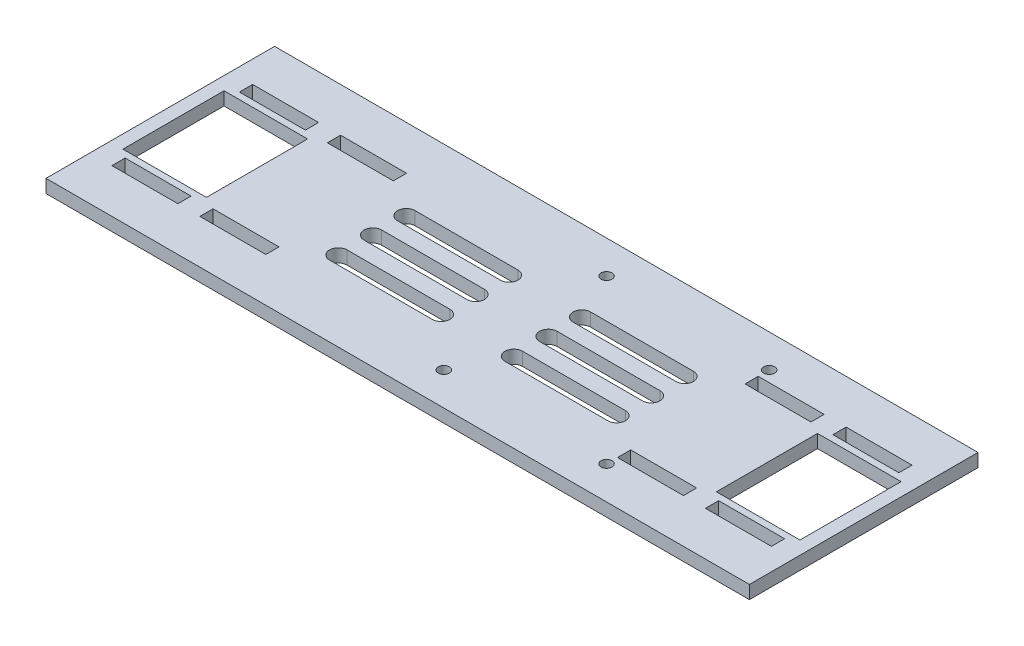
from build123d import *

# Parameters (mm, degrees)
SKETCH1_W           = 160
SKETCH1_H           = 52
SKETCH1_W_2         = 15
SKETCH1_H_2         = 3
SKETCH1_W_3         = 19
SKETCH1_H_3         = 23
BOSS_EXTRUDE1_DEPTH = 3
CUT_EXTRUDE1_DEPTH  = 3
SKETCH3_R           = 1.25
CUT_EXTRUDE2_DEPTH  = 10


with BuildPart() as part:
    # Sketch1 → Boss-Extrude1 (new body)
    with BuildSketch(Plane(origin=(0, 0, 0), x_dir=(1, 0, 0), z_dir=(0, 1, 0))):
        Rectangle(SKETCH1_W, SKETCH1_H)
        with Locations((67.5, 14.5)):
            Rectangle(SKETCH1_W_2, SKETCH1_H_2, mode=Mode.SUBTRACT)
        with Locations((47.5, 14.5)):
            Rectangle(SKETCH1_W_2, SKETCH1_H_2, mode=Mode.SUBTRACT)
        with Locations((67.5, 0)):
            Rectangle(SKETCH1_W_3, SKETCH1_H_3, mode=Mode.SUBTRACT)
        with Locations((67.5, -14.5)):
            Rectangle(SKETCH1_W_2, SKETCH1_H_2, mode=Mode.SUBTRACT)
        with Locations((47.5, -14.5)):
            Rectangle(SKETCH1_W_2, SKETCH1_H_2, mode=Mode.SUBTRACT)
        with Locations((-47.5, -14.5)):
            Rectangle(SKETCH1_W_2, SKETCH1_H_2, mode=Mode.SUBTRACT)
        with Locations((-67.5, -14.5)):
            Rectangle(SKETCH1_W_2, SKETCH1_H_2, mode=Mode.SUBTRACT)
        with Locations((-67.5, 0)):
            Rectangle(SKETCH1_W_3, SKETCH1_H_3, mode=Mode.SUBTRACT)
        with Locations((-47.5, 14.5)):
            Rectangle(SKETCH1_W_2, SKETCH1_H_2, mode=Mode.SUBTRACT)
        with Locations((-67.5, 14.5)):
            Rectangle(SKETCH1_W_2, SKETCH1_H_2, mode=Mode.SUBTRACT)
    extrude(amount=BOSS_EXTRUDE1_DEPTH)

    # Sketch2 → Cut-Extrude1 (cut)
    with BuildSketch(Plane(origin=(0, 3, 0), x_dir=(1, 0, 0), z_dir=(0, 1, 0))):
        with BuildLine():
            Line((-31.658505885, 2), (-8.266387648, 2))
            ThreePointArc((-8.266387648, 2), (-6.266387648, 0), (-8.266387648, -2))
            Line((-8.266387648, -2), (-31.658505885, -2))
            ThreePointArc((-31.658505885, -2), (-33.658505885, 0), (-31.658505885, 2))
        make_face()
        with BuildLine():
            Line((31.658505885, -9.856733432), (8.266387648, -9.856733432))
            ThreePointArc((8.266387648, -9.856733432), (6.266387648, -7.856733432), (8.266387648, -5.856733432))
            Line((8.266387648, -5.856733432), (31.658505885, -5.856733432))
            ThreePointArc((31.658505885, -5.856733432), (33.658505885, -7.856733432), (31.658505885, -9.856733432))
        make_face()
        with BuildLine():
            Line((-31.658505885, 9.620758334), (-8.266387648, 9.620758334))
            ThreePointArc((-8.266387648, 9.620758334), (-6.266387648, 7.620758334), (-8.266387648, 5.620758334))
            Line((-8.266387648, 5.620758334), (-31.658505885, 5.620758334))
            ThreePointArc((-31.658505885, 5.620758334), (-33.658505885, 7.620758334), (-31.658505885, 9.620758334))
        make_face()
        with BuildLine():
            Line((31.658505885, 5.620758334), (8.266387648, 5.620758334))
            ThreePointArc((8.266387648, 5.620758334), (6.266387648, 7.620758334), (8.266387648, 9.620758334))
            Line((8.266387648, 9.620758334), (31.658505885, 9.620758334))
            ThreePointArc((31.658505885, 9.620758334), (33.658505885, 7.620758334), (31.658505885, 5.620758334))
        make_face()
        with BuildLine():
            Line((-31.658505885, -5.856733432), (-8.266387648, -5.856733432))
            ThreePointArc((-8.266387648, -5.856733432), (-6.266387648, -7.856733432), (-8.266387648, -9.856733432))
            Line((-8.266387648, -9.856733432), (-31.658505885, -9.856733432))
            ThreePointArc((-31.658505885, -9.856733432), (-33.658505885, -7.856733432), (-31.658505885, -5.856733432))
        make_face()
        with BuildLine():
            Line((31.658505885, -2), (8.266387648, -2))
            ThreePointArc((8.266387648, -2), (6.266387648, 0), (8.266387648, 2))
            Line((8.266387648, 2), (31.658505885, 2))
            ThreePointArc((31.658505885, 2), (33.658505885, 0), (31.658505885, -2))
        make_face()
    extrude(amount=-CUT_EXTRUDE1_DEPTH, mode=Mode.SUBTRACT)

    # Sketch3 → Cut-Extrude2 (cut)
    with BuildSketch(Plane(origin=(0, 3, 0), x_dir=(1, 0, 0), z_dir=(0, 1, 0))):
        with Locations((40, 18.5)):
            Circle(SKETCH3_R)
        with Locations((40, -18.5)):
            Circle(SKETCH3_R)
        with Locations((3, -18.5)):
            Circle(SKETCH3_R)
        with Locations((3, 18.5)):
            Circle(SKETCH3_R)
    extrude(amount=-CUT_EXTRUDE2_DEPTH, mode=Mode.SUBTRACT)


solid = part.part
